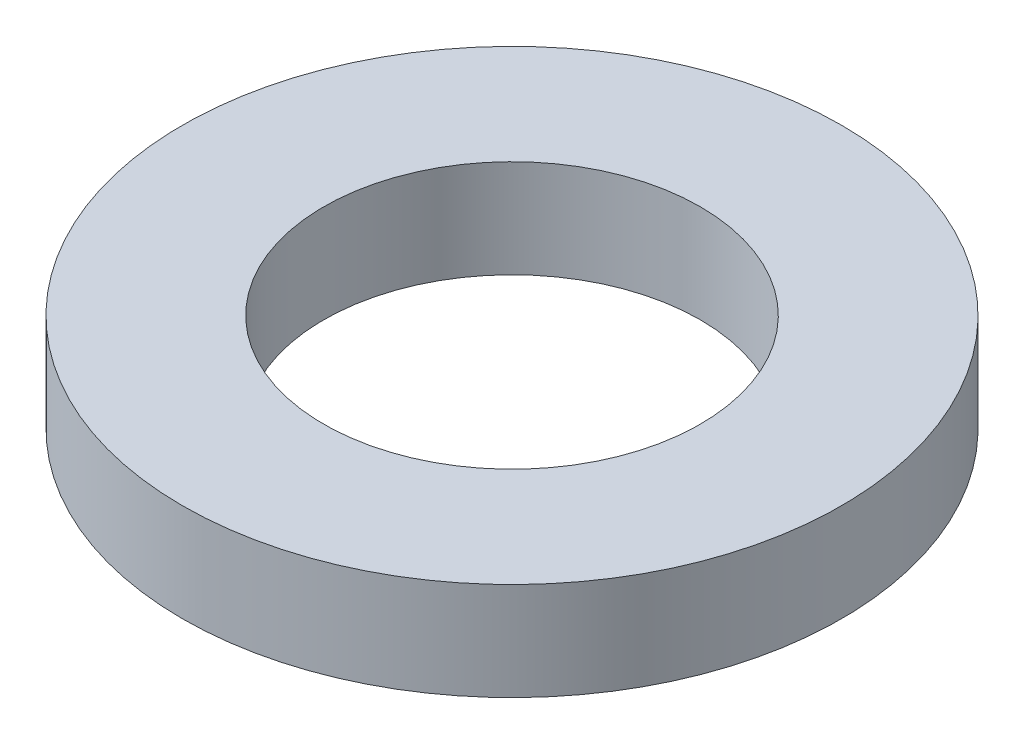
from build123d import *

# Parameters (mm, degrees)
SKETCH1_R           = 87.5
BOSS_EXTRUDE1_DEPTH = 26
SKETCH2_R           = 50
CUT_EXTRUDE1_DEPTH  = 127.445640494


with BuildPart() as part:
    # Sketch1 → Boss-Extrude1 (new body)
    with BuildSketch(Plane(origin=(0, 0, 0), x_dir=(1, 0, 0), z_dir=(0, 1, 0))):
        Circle(SKETCH1_R)
    extrude(amount=BOSS_EXTRUDE1_DEPTH)

    # Sketch2 → Cut-Extrude1 (cut, through all)
    with BuildSketch(Plane(origin=(0, 0, 0), x_dir=(1, 0, 0), z_dir=(0, 1, 0))):
        Circle(SKETCH2_R)
    extrude(amount=CUT_EXTRUDE1_DEPTH, mode=Mode.SUBTRACT)


solid = part.part
